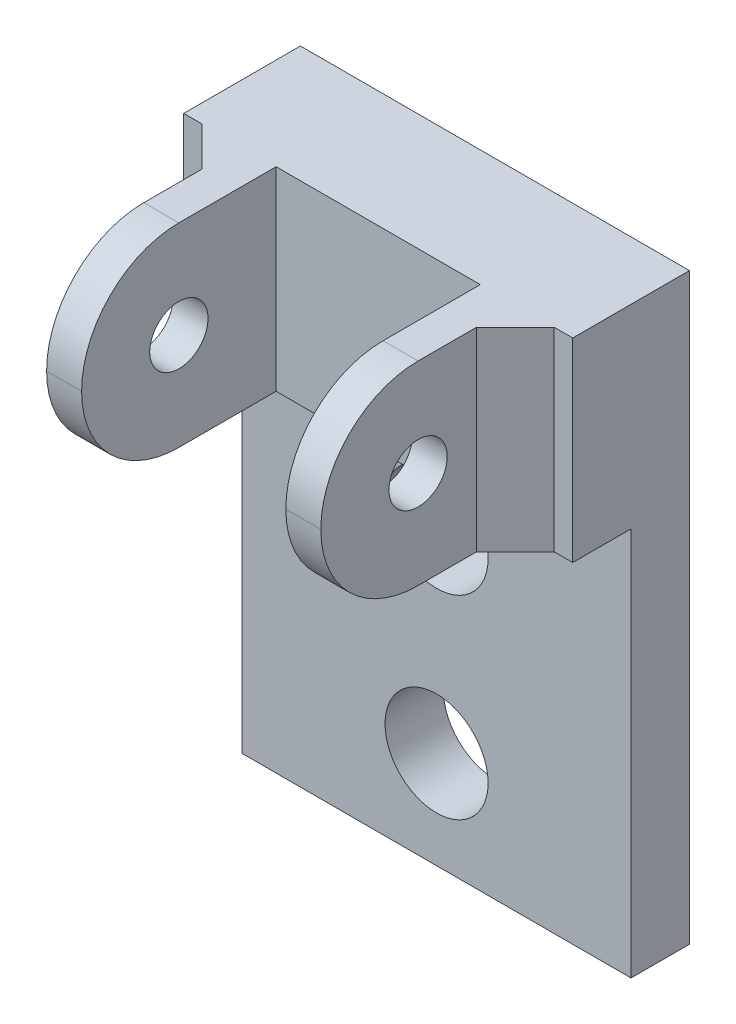
from build123d import *

# Parameters (mm, degrees)
SKETCH1_W           = 20
SKETCH1_H           = 30
SKETCH1_R           = 2.65
BOSS_EXTRUDE1_DEPTH = 3
SKETCH2_W           = 20
SKETCH2_H           = 10
BOSS_EXTRUDE2_DEPTH = 3
SKETCH3_W           = 1.8
SKETCH3_H           = 10
BOSS_EXTRUDE3_DEPTH = 10
FILLET1_R           = 5
CUT_EXTRUDE1_REACH  = 29.78
SKETCH4_R           = 1.5
CHAMFER1_SIZE       = 2


with BuildPart() as part:
    # Sketch1 → Boss-Extrude1 (new body)
    with BuildSketch(Plane.XY):
        Rectangle(SKETCH1_W, SKETCH1_H)
        with Locations((0, -10)):
            Circle(SKETCH1_R, mode=Mode.SUBTRACT)
        Circle(SKETCH1_R, mode=Mode.SUBTRACT)
    extrude(amount=BOSS_EXTRUDE1_DEPTH)

    # Sketch2 → Boss-Extrude2 (add)
    with BuildSketch(Plane.XY.offset(3)):
        with Locations((0, 10)):
            Rectangle(SKETCH2_W, SKETCH2_H)
    extrude(amount=BOSS_EXTRUDE2_DEPTH)

    # Sketch3 → Boss-Extrude3 (add)
    with BuildSketch(Plane.XY.offset(6)):
        with Locations((-6.15, 10)):
            Rectangle(SKETCH3_W, SKETCH3_H)
        with Locations((6.15, 10)):
            Rectangle(SKETCH3_W, SKETCH3_H)
    extrude(amount=BOSS_EXTRUDE3_DEPTH)

    # Fillet1
    fillet1_edges = [part.edges().sort_by_distance(p)[0] for p in [
        (6.15, 5, 16),
        (-6.15, 5, 16),
        (6.15, 15, 16),
        (-6.15, 15, 16),
    ]]
    fillet(fillet1_edges, radius=FILLET1_R - 0.0001)  # a hair under: the kernel refuses the full size

    # Cut-Extrude1: up to this face of the body (flat: up to its plane)
    cut_extrude1_end = Plane(part.part.faces().sort_by_distance((7.05, 10, 10.533268934))[0])
    # Sketch4 → Cut-Extrude1 (cut, up to the picked face)
    with BuildSketch(Plane.ZY.offset(7.05), mode=Mode.PRIVATE) as cut_extrude1_sk1:
        with Locations(Location((11, 10, 0), (0, 0, 270))):
            Circle(SKETCH4_R)
    cut_extrude1_tool1 = split(extrude(cut_extrude1_sk1.sketch, amount=-CUT_EXTRUDE1_REACH, mode=Mode.PRIVATE), bisect_by=cut_extrude1_end, keep=Keep.BOTH, mode=Mode.PRIVATE)
    add(cut_extrude1_tool1.solids().sort_by(Axis((-7.05, 10, 11), (1, 0, 0)))[0], mode=Mode.SUBTRACT)

    # Chamfer1
    chamfer1_edges = [part.edges().sort_by_distance(p)[0] for p in [
        (-7.05, 10, 6),
        (7.05, 10, 6),
    ]]
    chamfer(chamfer1_edges, length=CHAMFER1_SIZE)


solid = part.part
